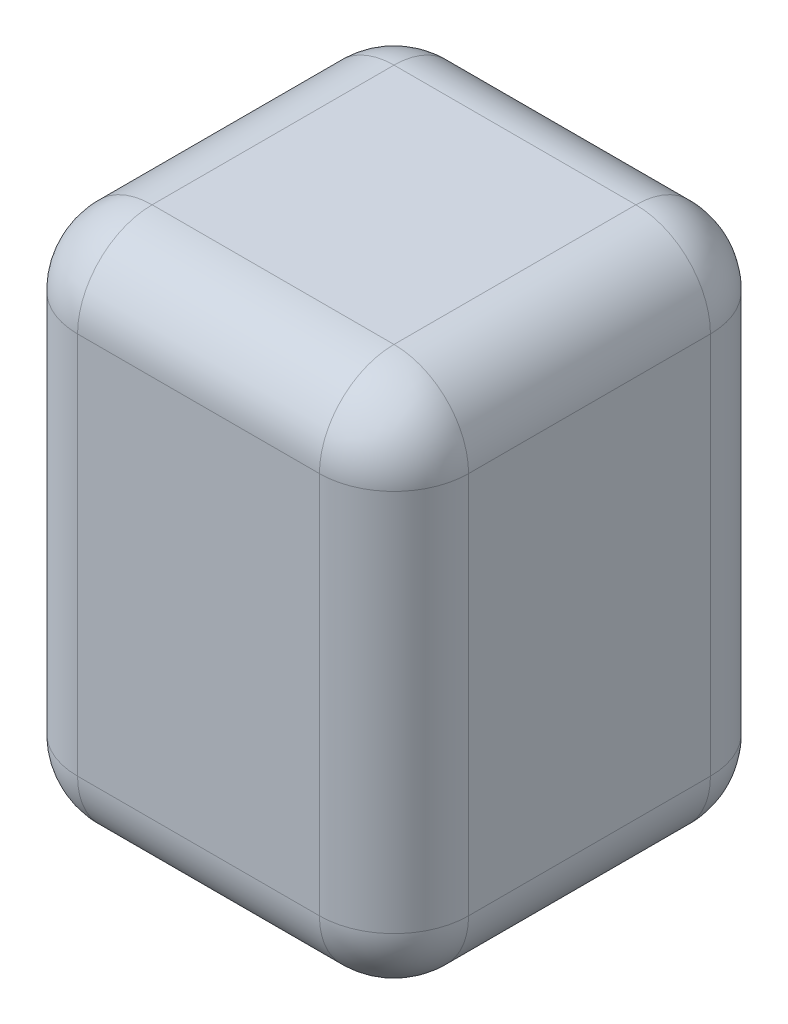
from build123d import *

# Parameters (mm, degrees)
SKETCH1_W           = 97
SKETCH1_H           = 97
BOSS_EXTRUDE1_DEPTH = 132
FILLET1_R           = 18.5


with BuildPart() as part:
    # Sketch1 → Boss-Extrude1 (new body)
    with BuildSketch(Plane(origin=(0, 0, 0), x_dir=(1, 0, 0), z_dir=(0, 1, 0))):
        Rectangle(SKETCH1_W, SKETCH1_H)
    extrude(amount=BOSS_EXTRUDE1_DEPTH)

    # Fillet1
    fillet1_edges = [part.edges().sort_by_distance(p)[0] for p in [
        (0, 0, -48.5),
        (48.5, 66, -48.5),
        (48.5, 0, 0),
        (-48.5, 66, -48.5),
        (-48.5, 0, 0),
        (-48.5, 66, 48.5),
        (48.5, 66, 48.5),
        (0, 0, 48.5),
        (0, 132, -48.5),
        (48.5, 132, 0),
        (0, 132, 48.5),
        (-48.5, 132, 0),
    ]]
    fillet(fillet1_edges, radius=FILLET1_R)


solid = part.part
